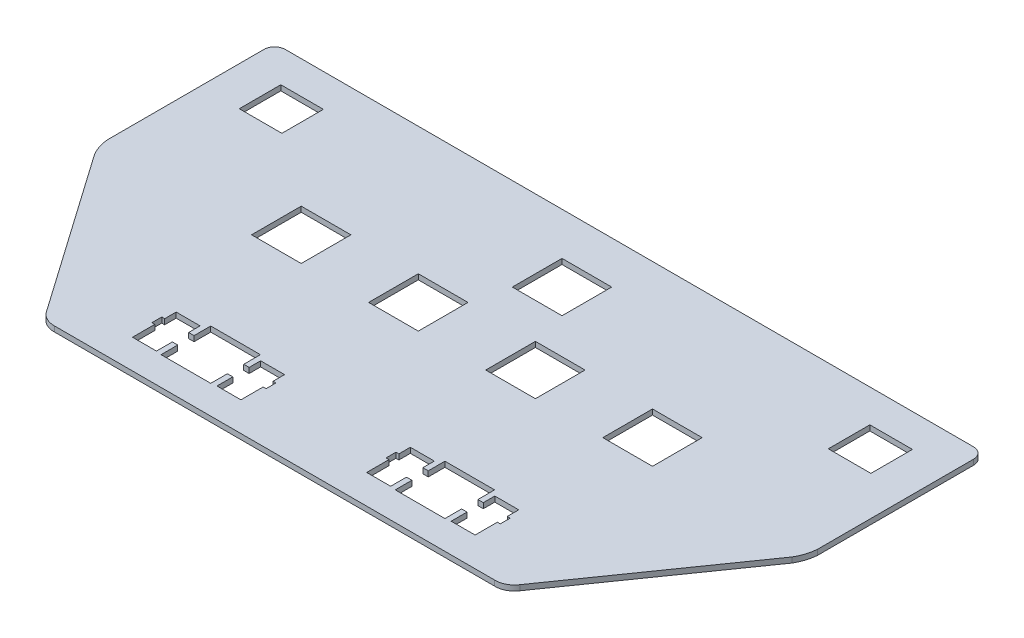
from build123d import *

# Parameters (mm, degrees)
SKETCH_1_W      = 14
SKETCH_1_H      = 14
SKETCH_1_W_2    = 12
SKETCH_1_H_2    = 11.7
EXTRUDE_1_DEPTH = 1.5


with BuildPart() as part:
    # 草图1 → 凸台-拉伸1 (new body)
    with BuildSketch(Plane(origin=(0, 0, 0), x_dir=(1, 0, 0), z_dir=(0, 1, 0))):
        with BuildLine():
            Line((197, 0), (3, 0))
            ThreePointArc((3, 0), (0.878679656, -0.878679656), (0, -3))
            Line((0, -3), (0, -47))
            ThreePointArc((0, -47), (0.538734236, -49.830178992), (1.720387033, -52.457695762))
            Line((1.720387033, -52.457695762), (33.279612967, -97.542304238))
            ThreePointArc((33.279612967, -97.542304238), (35.317699373, -99.389808931), (38, -100))
            Line((38, -100), (162, -100))
            ThreePointArc((162, -100), (164.682300627, -99.389808931), (166.720387033, -97.542304238))
            Line((166.720387033, -97.542304238), (198.279612967, -52.457695762))
            ThreePointArc((198.279612967, -52.457695762), (199.461265764, -49.830178992), (200, -47))
            Line((200, -47), (200, -3))
            ThreePointArc((200, -3), (199.121320344, -0.878679656), (197, 0))
        make_face()
        with Locations((100, -19)):
            Rectangle(SKETCH_1_W, SKETCH_1_H, mode=Mode.SUBTRACT)
        with Locations((83.5, -43)):
            Rectangle(SKETCH_1_W, SKETCH_1_H, mode=Mode.SUBTRACT)
        with Locations((116.5, -43)):
            Rectangle(SKETCH_1_W, SKETCH_1_H, mode=Mode.SUBTRACT)
        with Locations((50.5, -43)):
            Rectangle(SKETCH_1_W, SKETCH_1_H, mode=Mode.SUBTRACT)
        with Locations((149.5, -43)):
            Rectangle(SKETCH_1_W, SKETCH_1_H, mode=Mode.SUBTRACT)
        Polygon((60, -78), (74, -78), (74, -82.7), (75.525, -82.7), (75.525, -79.47), (82.275, -79.47), (82.275, -82.7), (83.1, -82.7), (83.1, -85.5), (82.275, -85.5), (82.275, -91.77), (75.525, -91.77), (75.525, -87.3), (74, -87.3), (74, -92), (60, -92), (60, -87.3), (58.475, -87.3), (58.475, -91.77), (51.725, -91.77), (51.725, -85.5), (50.9, -85.5), (50.9, -82.7), (51.725, -82.7), (51.725, -79.47), (58.475, -79.47), (58.475, -82.7), (60, -82.7), align=None, mode=Mode.SUBTRACT)
        Polygon((140, -78), (126, -78), (126, -82.7), (124.475, -82.7), (124.475, -79.47), (117.725, -79.47), (117.725, -82.7), (116.9, -82.7), (116.9, -85.5), (117.725, -85.5), (117.725, -91.77), (124.475, -91.77), (124.475, -87.3), (126, -87.3), (126, -92), (140, -92), (140, -87.3), (141.525, -87.3), (141.525, -91.77), (148.275, -91.77), (148.275, -85.5), (149.1, -85.5), (149.1, -82.7), (148.275, -82.7), (148.275, -79.47), (141.525, -79.47), (141.525, -82.7), (140, -82.7), align=None, mode=Mode.SUBTRACT)
        with Locations((17, -15.1)):
            Rectangle(SKETCH_1_W_2, SKETCH_1_H_2, mode=Mode.SUBTRACT)
        with Locations((183, -15.1)):
            Rectangle(SKETCH_1_W_2, SKETCH_1_H_2, mode=Mode.SUBTRACT)
    extrude(amount=EXTRUDE_1_DEPTH)


solid = part.part
